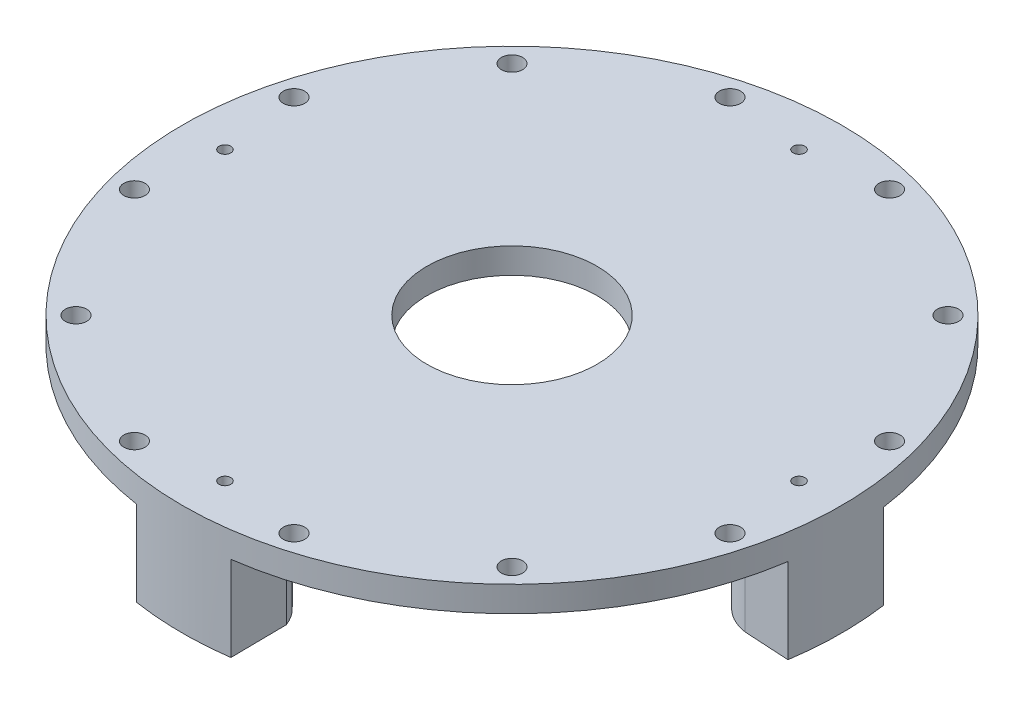
from build123d import *

# Parameters (mm, degrees)
SKETCH1_R           = 98.425
SKETCH1_R_2         = 25.4
BOSS_EXTRUDE1_DEPTH = 7.62
BOSS_EXTRUDE2_START = 25.4
BOSS_EXTRUDE2_DEPTH = 25.4
SKETCH5_R           = 5.2578
CUT_EXTRUDE3_DEPTH  = 19.05
SKETCH6_R           = 3.175
CUT_EXTRUDE4_DEPTH  = 12.7
CIRPATTERN1_COUNT   = 12
CIRPATTERN2_COUNT   = 4
SKETCH8_R           = 1.7526
CUT_EXTRUDE6_DEPTH  = 144.056917519
CIRPATTERN3_COUNT   = 4


with BuildPart() as part:
    # Sketch1 → Boss-Extrude1 (new body)
    with BuildSketch(Plane(origin=(0, 0, 0), x_dir=(1, 0, 0), z_dir=(0, 1, 0))):
        Circle(SKETCH1_R)
        Circle(SKETCH1_R_2, mode=Mode.SUBTRACT)
    extrude(amount=BOSS_EXTRUDE1_DEPTH)

    # Sketch2 → Boss-Extrude2 (add)
    with BuildSketch(Plane.XZ.offset(BOSS_EXTRUDE2_START)):
        with BuildLine():
            Line((-14.092921054, 83.751577801), (-14.875155352, 97.29445194))
            ThreePointArc((-14.875155352, 97.29445194), (-0.679076319, 98.422657353), (13.531218764, 97.490444372))
            Line((13.531218764, 97.490444372), (13.333659481, 80.753245397))
            ThreePointArc((13.333659481, 80.753245397), (-1.546485964, 71.578862712), (-14.092921054, 83.751577801))
        make_face()
        with BuildLine():
            Line((83.751577801, 14.092921054), (97.29445194, 14.875155352))
            ThreePointArc((97.29445194, 14.875155352), (98.422657353, 0.679076319), (97.490444372, -13.531218764))
            Line((97.490444372, -13.531218764), (80.753245397, -13.333659481))
            ThreePointArc((80.753245397, -13.333659481), (71.578862712, 1.546485964), (83.751577801, 14.092921054))
        make_face()
        with BuildLine():
            Line((14.092921054, -83.751577801), (14.875155352, -97.29445194))
            ThreePointArc((14.875155352, -97.29445194), (0.679076319, -98.422657353), (-13.531218764, -97.490444372))
            Line((-13.531218764, -97.490444372), (-13.333659481, -80.753245397))
            ThreePointArc((-13.333659481, -80.753245397), (1.546485964, -71.578862712), (14.092921054, -83.751577801))
        make_face()
        with BuildLine():
            Line((-83.751577801, -14.092921054), (-97.29445194, -14.875155352))
            ThreePointArc((-97.29445194, -14.875155352), (-98.422657353, -0.679076319), (-97.490444372, 13.531218764))
            Line((-97.490444372, 13.531218764), (-80.753245397, 13.333659481))
            ThreePointArc((-80.753245397, 13.333659481), (-71.578862712, -1.546485964), (-83.751577801, -14.092921054))
        make_face()
    extrude(amount=-BOSS_EXTRUDE2_DEPTH)

    # Sketch5 → Cut-Extrude3 (cut)
    with BuildSketch(Plane.XZ.offset(25.4)):
        with Locations((0, 85.725)):
            Circle(SKETCH5_R)
    cut_extrude3 = extrude(amount=-CUT_EXTRUDE3_DEPTH, mode=Mode.SUBTRACT)

    # Sketch6 → Cut-Extrude4 (cut)
    with BuildSketch(Plane(origin=(0, 7.62, 0), x_dir=(1, 0, 0), z_dir=(0, 1, 0))):
        with Locations((-23.830763578, 88.937620456)):
            Circle(SKETCH6_R)
    cut_extrude4 = extrude(amount=-CUT_EXTRUDE4_DEPTH, mode=Mode.SUBTRACT)

    # CirPattern1: Cut-Extrude4 ×12 about axis
    cirpattern1_axis = Axis((0, 7.62, 0), (0, -1, 0))
    for i in range(1, CIRPATTERN1_COUNT):
        add(cut_extrude4.rotate(cirpattern1_axis, i * 360 / CIRPATTERN1_COUNT), mode=Mode.SUBTRACT)

    # CirPattern2: Cut-Extrude3 ×4 about axis
    cirpattern2_axis = Axis((0, 7.62, 0), (0, -1, 0))
    for i in range(1, CIRPATTERN2_COUNT):
        add(cut_extrude3.rotate(cirpattern2_axis, i * 360 / CIRPATTERN2_COUNT), mode=Mode.SUBTRACT)

    # Sketch8 → Cut-Extrude6 (cut, through all)
    with BuildSketch(Plane(origin=(0, 7.62, 0), x_dir=(1, 0, 0), z_dir=(0, 1, 0))):
        with Locations((0, 85.725)):
            Circle(SKETCH8_R)
    cut_extrude6 = extrude(amount=-CUT_EXTRUDE6_DEPTH, mode=Mode.SUBTRACT)

    # CirPattern3: Cut-Extrude6 ×4 about axis
    cirpattern3_axis = Axis((0, 7.62, 0), (0, -1, 0))
    for i in range(1, CIRPATTERN3_COUNT):
        add(cut_extrude6.rotate(cirpattern3_axis, i * 360 / CIRPATTERN3_COUNT), mode=Mode.SUBTRACT)


solid = part.part
